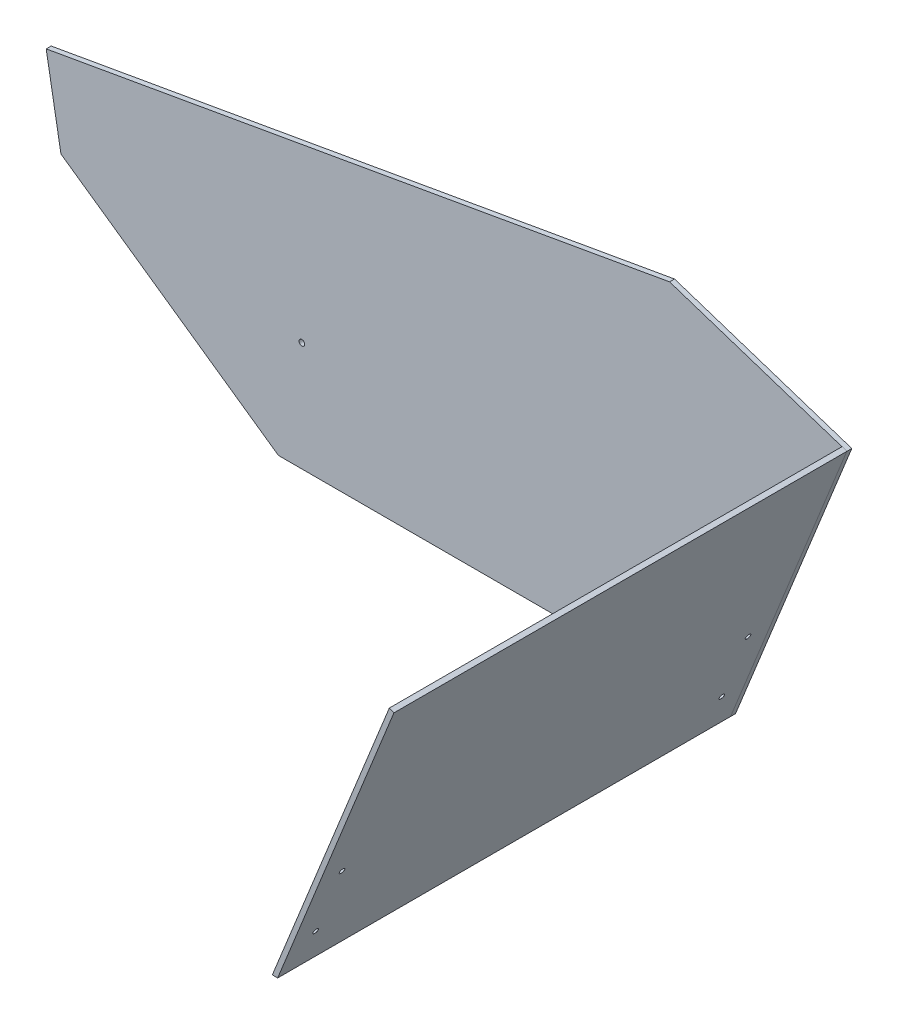
from build123d import *

# Parameters (mm, degrees)
BOSS_EXTRUDE1_DEPTH           = 290
BOSS_EXTRUDE2_DEPTH           = 3.175
M3_CLEARANCE_HOLE1_AT_2_COUNT = 2
M3_CLEARANCE_HOLE1_AT_2_PITCH = 45
M3_CLEARANCE_HOLE1_AT_3_COUNT = 2
M3_CLEARANCE_HOLE1_AT_3_PITCH = 260
M3_CLEARANCE_HOLE1_AT_4_COUNT = 2
M3_CLEARANCE_HOLE1_AT_4_PITCH = 263.865496039
SKETCH6_W                     = 1.8
SKETCH6_H                     = 293.175
M3_CLEARANCE_HOLE2_AT_2_COUNT = 2
M3_CLEARANCE_HOLE2_AT_2_PITCH = 259.49523496


with BuildPart() as part:
    # Sketch1 → Boss-Extrude1 (new body)
    with BuildSketch(Plane.XY):
        Polygon((140, 0), (143.424347808, 0), (217.865127421, 184.247394979), (214.921318683, 185.436770913), align=None)
    extrude(amount=BOSS_EXTRUDE1_DEPTH)

    # Sketch4 → M3 Clearance Hole1 (revolve, cut)
    with BuildSketch(Plane(origin=(169.646809347, 64.90286982, 275), x_dir=(0.3746065934159096, 0.9271838545667884, 0), z_dir=(0, 0, 1))):
        Polygon((0, 0), (0, 489.265093346), (1.7, 489.265093346), (1.7, 0.025), (1.725, 0), align=None)
    m3_clearance_hole1 = revolve(axis=Axis((175.534426824, 62.524117951, 275), (-0.9271838545667884, 0.3746065934159096, 0)), mode=Mode.SUBTRACT)

    # M3 Clearance Hole1 at 2: M3 Clearance Hole1 ×2
    with Locations(*[Vector(-0.3746065934159096, -0.9271838545667884, 0) * (i * M3_CLEARANCE_HOLE1_AT_2_PITCH) for i in range(1, M3_CLEARANCE_HOLE1_AT_2_COUNT)]):
        add(m3_clearance_hole1, mode=Mode.SUBTRACT)

    # M3 Clearance Hole1 at 3: M3 Clearance Hole1 ×2
    with Locations(*[(0, 0, -i * M3_CLEARANCE_HOLE1_AT_3_PITCH) for i in range(1, M3_CLEARANCE_HOLE1_AT_3_COUNT)]):
        add(m3_clearance_hole1, mode=Mode.SUBTRACT)

    # M3 Clearance Hole1 at 4: M3 Clearance Hole1 ×2
    with Locations(*[Vector(-0.06388594551675915, -0.15812326386660155, -0.9853505058554559) * (i * M3_CLEARANCE_HOLE1_AT_4_PITCH) for i in range(1, M3_CLEARANCE_HOLE1_AT_4_COUNT)]):
        add(m3_clearance_hole1, mode=Mode.SUBTRACT)


with BuildPart() as body_2:
    # Sketch2 → Boss-Extrude2 (new body)
    with BuildSketch(Plane.XY):
        Polygon((-294.777867348, 151.108031048), (104.369939009, 221.488558599), (217.865127421, 184.247394979), (143.424347808, 0), (-146.070887152, 0), (-285.326734681, 97.50799418), align=None)
    extrude(amount=-BOSS_EXTRUDE2_DEPTH)

    # Sketch6 → M3 Clearance Hole2 (revolve, cut)
    with BuildSketch(Plane(origin=(128.424347808, 70, -3.175), x_dir=(0, 1, 0), z_dir=(1, 0, 0))):
        with Locations((0.9, 146.5875)):
            Rectangle(SKETCH6_W, SKETCH6_H)
    m3_clearance_hole2 = revolve(axis=Axis((128.424347808, 70, -9.525), (0, 0, 1)), mode=Mode.SUBTRACT)

    # M3 Clearance Hole2 at 2: M3 Clearance Hole2 ×2
    with Locations(*[(-i * M3_CLEARANCE_HOLE2_AT_2_PITCH, 0, 0) for i in range(1, M3_CLEARANCE_HOLE2_AT_2_COUNT)]):
        add(m3_clearance_hole2, mode=Mode.SUBTRACT)


solid = Compound([part.part, body_2.part])
